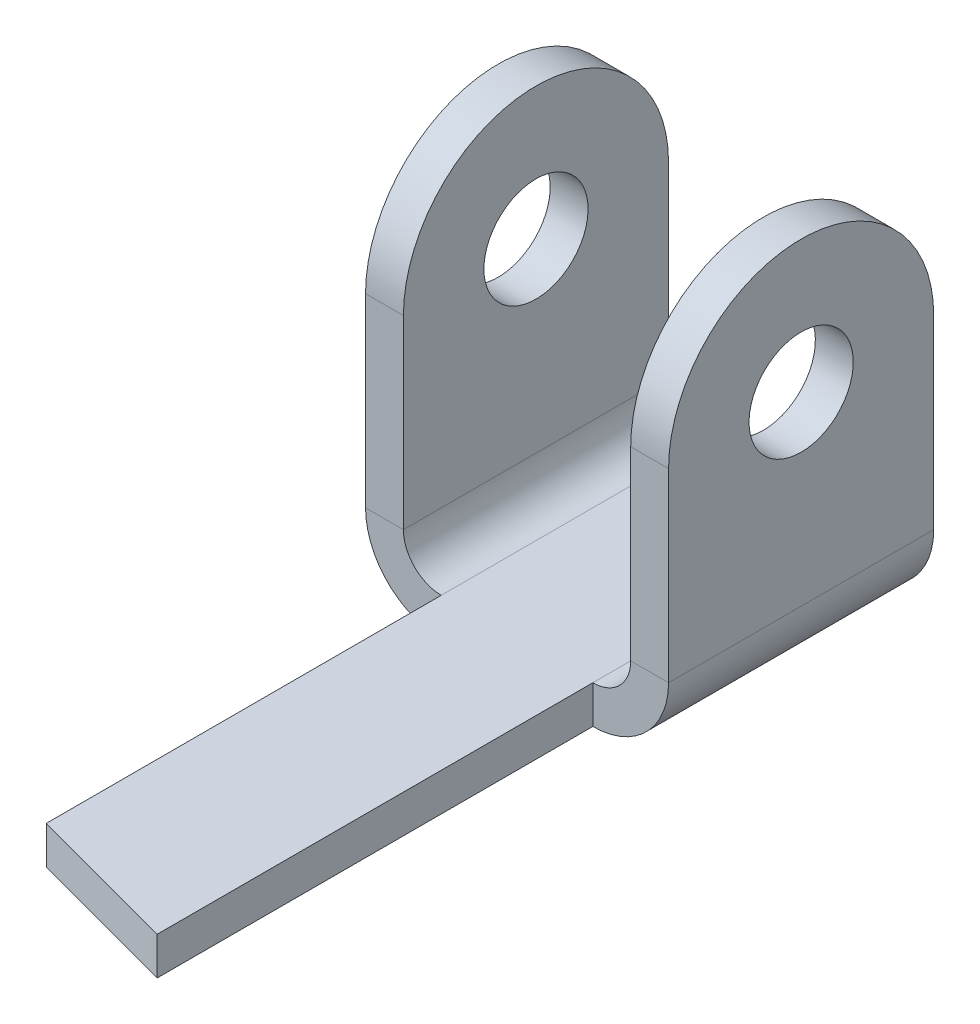
from build123d import *

# Parameters (mm, degrees)
SKETCH_2_W                  = 8
SKETCH_2_H                  = 37
SM_BASE_FLANGE_1_DEPTH      = 2
SM_EDGE_FLANGE_1_DEPTH      = 14
SM_START                    = 2
SM_EDGE_FLANGE_1_FLAT_DEPTH = 2
HOLE_WIZARD_M5_2_D          = 5.5
CUT_EXTRUDE_1_DEPTH         = 28.555654592
CUT_EXTRUDE_1_DEPTH_BACK    = 28.555654592


# Sheet-metal steps are written as plain solids
with BuildPart() as part:
    # Sketch 2 → 基体-法兰1 (new body)
    with BuildSketch(Plane(origin=(0, 0, 0), x_dir=(1, 0, 0), z_dir=(0, 1, 0))):
        Rectangle(SKETCH_2_W, SKETCH_2_H)
    extrude(amount=-SM_BASE_FLANGE_1_DEPTH)

    # 边线-法兰1 bend section (across the edge) → 边线-法兰1 (add)
    with BuildSketch(Plane(origin=(-6, 0, -18.5), x_dir=(1, 0, 0), z_dir=(0, 0, 1))):
        with BuildLine():
            Line((-2, 2), (0, 2))
            ThreePointArc((0, 2), (0.585786438, 0.585786438), (2, 0))
            Line((2, 0), (2, -2))
            ThreePointArc((2, -2), (-0.828427125, -0.828427125), (-2, 2))
        make_face()
    sm_edge_flange_1 = extrude(amount=SM_EDGE_FLANGE_1_DEPTH)

    # 边线-法兰1 profile (on flange) → 边线-法兰1 flat (add)
    with BuildSketch(Plane.ZY.offset(6).offset(SM_START)):
        with BuildLine():
            ThreePointArc((-4.5, 11.79), (-11.5, 18.79), (-18.5, 11.79))
            Line((-18.5, 11.79), (-18.5, 2))
            Line((-18.5, 2), (-4.5, 2))
            Line((-4.5, 2), (-4.5, 11.79))
        make_face()
    sm_edge_flange_1_flat = extrude(amount=-SM_EDGE_FLANGE_1_FLAT_DEPTH)

    # 镜向1: 边线-法兰1, 边线-法兰1 flat across plane
    add(sm_edge_flange_1.mirror(Plane(origin=(0, 0, 0), x_dir=(0, 0, 1), z_dir=(1, 0, 0))))
    add(sm_edge_flange_1_flat.mirror(Plane(origin=(0, 0, 0), x_dir=(0, 0, 1), z_dir=(1, 0, 0))))

    # M5 间隙孔2 (through all)
    with Locations(Plane.ZY.offset(8)):
        with Locations((-11.5, 11.79)):
            Hole(HOLE_WIZARD_M5_2_D / 2)

    # 草图22 → 切除-拉伸1 (cut, two sides: drawn at the far end of the back side and taken through both)
    with BuildSketch(Plane(origin=(0, 0, 0), x_dir=(1, 0, 0), z_dir=(0, 1, 0)).offset(-CUT_EXTRUDE_1_DEPTH_BACK)):
        Polygon((88.803072858, -41.222914888), (4, -18.5), (-4, -16.356406461), (-88.803072858, 6.366508427), (-134.248902633, -163.239637288), (43.357243082, -210.829060603), align=None)
    extrude(amount=CUT_EXTRUDE_1_DEPTH + CUT_EXTRUDE_1_DEPTH_BACK, mode=Mode.SUBTRACT)


solid = part.part
